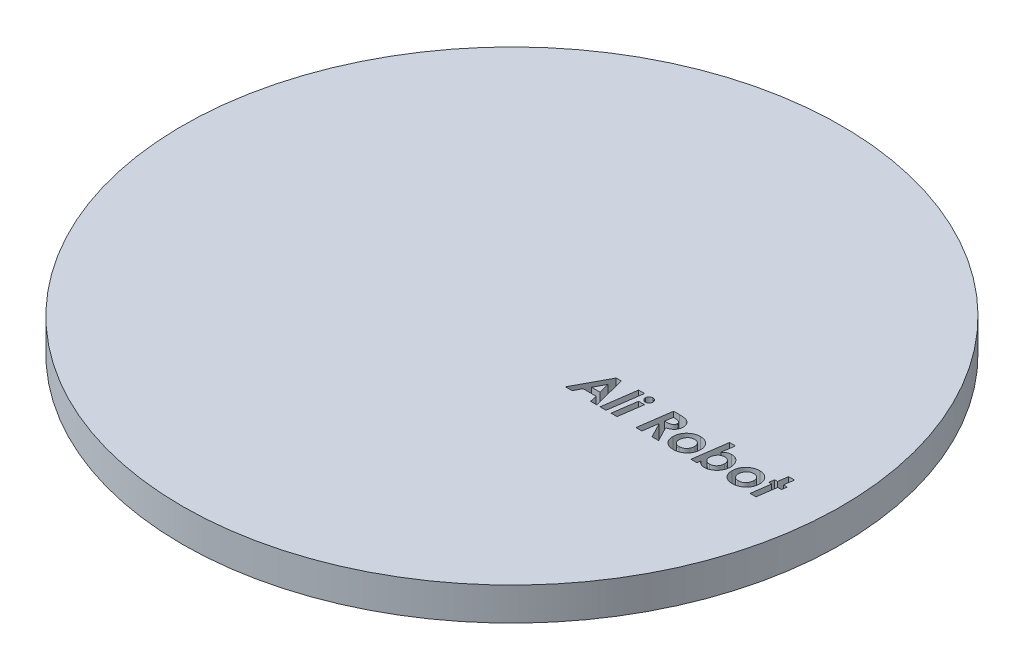
from build123d import *

# Parameters (mm, degrees)
SKETCH2_R           = 35
BOSS_EXTRUDE1_DEPTH = 3.5
SKETCH33_R          = 30
BOSS_EXTRUDE3_DEPTH = 2.2
CUT_EXTRUDE24_DEPTH = 3
SKETCH35_W          = 5.8
SKETCH35_H          = 3.4
BOSS_EXTRUDE4_DEPTH = 6
SHELL2_T            = 1


with BuildPart() as part:
    # Sketch2 → Boss-Extrude1 (new body)
    with BuildSketch(Plane(origin=(0, 0, 0), x_dir=(1, 0, 0), z_dir=(0, 1, 0))):
        Circle(SKETCH2_R)
    extrude(amount=BOSS_EXTRUDE1_DEPTH)

    # Sketch33 → Boss-Extrude3 (add)
    with BuildSketch(Plane.XZ):
        Circle(SKETCH33_R)
    extrude(amount=BOSS_EXTRUDE3_DEPTH)

    # Sketch38 → Cut-Extrude24 (cut)
    # profile 1 of 9: a face of its own
    with BuildSketch(Plane(origin=(0, 3.5, 0), x_dir=(1, 0, 0), z_dir=(0, 1, 0))):
        Polygon((11.234213374, -0.170104505), (11.785295104, -0.170104505), (12.673616419, -3.670104505), (12.027182124, -3.670104505), (11.833672508, -2.907283992), (10.469289496, -2.907283992), (10.059834367, -3.670104505), (9.353103598, -3.670104505), align=None)
        Polygon((11.684333566, -2.323950659), (11.395471387, -1.184627742), (10.78339206, -2.323950659), align=None, mode=Mode.SUBTRACT)
    # profile 2 of 9: a face of its own
    with BuildSketch(Plane(origin=(0, 3.5, 0), x_dir=(1, 0, 0), z_dir=(0, 1, 0))):
        Polygon((13.535996226, -0.080360915), (14.169810329, -0.080360915), (13.66640488, -3.670104505), (13.032590778, -3.670104505), align=None)
    # profile 3 of 9: a face of its own
    with BuildSketch(Plane(origin=(0, 3.5, 0), x_dir=(1, 0, 0), z_dir=(0, 1, 0))):
        with BuildLine():
            add(Edge.make_bspline(
                [(15.006949752, -0.03548912), (15.033724236, -0.037050399), (15.086317182, -0.040117209), (15.162584245, -0.062149233), (15.231434376, -0.101556531), (15.293403814, -0.152881213), (15.344728495, -0.21485065), (15.384135793, -0.283700781), (15.406167817, -0.359967844), (15.409234627, -0.41256079), (15.410795906, -0.439335274)],
                knots=[0, 0, 0, 0, 1.014134371, 1.992057583, 2.975098753, 4, 5.024901247, 6.007942417, 6.985865629, 8, 8, 8, 8], degree=3))
            add(Edge.make_bspline(
                [(15.410795906, -0.439335274), (15.409245272, -0.466115808), (15.406199373, -0.518720637), (15.383956784, -0.595099209), (15.344970591, -0.664433822), (15.29334378, -0.726417249), (15.231646153, -0.777958507), (15.162369408, -0.816365475), (15.086344614, -0.83860223), (15.03373349, -0.841636642), (15.006949752, -0.843181428)],
                knots=[0, 0, 0, 0, 1.013694729, 1.991193998, 2.981551723, 4.006008661, 5.030465598, 6.008806002, 6.986305271, 8, 8, 8, 8], degree=3))
            add(Edge.make_bspline(
                [(15.006949752, -0.843181428), (14.980160104, -0.841647208), (14.927537372, -0.83863355), (14.85139842, -0.816186723), (14.781641719, -0.77820039), (14.719927005, -0.726358021), (14.668084636, -0.664643307), (14.630098303, -0.594886606), (14.607651476, -0.518747654), (14.604637818, -0.466124922), (14.603103598, -0.439335274)],
                knots=[0, 0, 0, 0, 1.01324697, 1.990314468, 2.975995575, 4, 5.024004425, 6.009685532, 6.98675303, 8, 8, 8, 8], degree=3))
            add(Edge.make_bspline(
                [(14.603103598, -0.439335274), (14.604648384, -0.412551536), (14.607682796, -0.359940413), (14.629919552, -0.283915618), (14.668326519, -0.214638873), (14.719867777, -0.152941246), (14.781851204, -0.101314435), (14.851185818, -0.062328242), (14.927564389, -0.040085653), (14.980169218, -0.037039754), (15.006949752, -0.03548912)],
                knots=[0, 0, 0, 0, 1.013694729, 1.991193998, 2.969534402, 3.993991339, 5.018448277, 6.008806002, 6.986305271, 8, 8, 8, 8], degree=3))
        make_face()
    # profile 4 of 9: a face of its own
    with BuildSketch(Plane(origin=(0, 3.5, 0), x_dir=(1, 0, 0), z_dir=(0, 1, 0))):
        Polygon((14.562438534, -1.112412197), (15.196252637, -1.112412197), (14.833071547, -3.670104505), (14.199257444, -3.670104505), align=None)
    # profile 5 of 9: a face of its own
    with BuildSketch(Plane(origin=(0, 3.5, 0), x_dir=(1, 0, 0), z_dir=(0, 1, 0))):
        with BuildLine():
            Line((17.337478598, -0.170104505), (17.945351194, -0.170104505))
            add(Edge.make_bspline(
                [(17.945351194, -0.170104505), (17.990461912, -0.170288853), (18.0774408, -0.170644298), (18.20251927, -0.175698725), (18.317320027, -0.183324297), (18.421706567, -0.19338775), (18.515766042, -0.207350229), (18.599302851, -0.224114981), (18.672850562, -0.242784868), (18.716956864, -0.260134145), (18.737618822, -0.268261556)],
                knots=[0, 0, 0, 0, 1.348808202, 2.600664361, 3.742342956, 4.788858012, 5.735658768, 6.584006912, 7.336666444, 8, 8, 8, 8], degree=3))
            add(Edge.make_bspline(
                [(18.737618822, -0.268261556), (18.760881531, -0.278751926), (18.806356444, -0.29925894), (18.871519344, -0.334019586), (18.932539327, -0.371466236), (18.988405098, -0.413010751), (19.040295597, -0.456903826), (19.087889056, -0.503562941), (19.130802248, -0.55370417), (19.169485538, -0.606428163), (19.203882551, -0.661666729), (19.233408844, -0.719692265), (19.258939718, -0.780013512), (19.278877214, -0.843286871), (19.29544767, -0.908752815), (19.30616484, -0.97682439), (19.313707078, -1.04727198), (19.314326819, -1.095096686), (19.31464206, -1.119423415)],
                knots=[0, 0, 0, 0, 1.116361014, 2.182309107, 3.229450697, 4.24598407, 5.225421932, 6.201651319, 7.158895679, 8.110002388, 9.060669178, 10.002827475, 10.956240434, 11.923213192, 12.902917952, 13.908279153, 14.936015885, 16, 16, 16, 16], degree=3))
            add(Edge.make_bspline(
                [(19.31464206, -1.119423415), (19.313900694, -1.14935913), (19.312437117, -1.208457078), (19.302873802, -1.295604951), (19.285037031, -1.379232383), (19.261016279, -1.459602808), (19.231256497, -1.537236615), (19.192877363, -1.610782918), (19.148515858, -1.681523171), (19.097282847, -1.748529924), (19.040017621, -1.812417855), (18.973896349, -1.869427088), (18.902576953, -1.923391655), (18.823129531, -1.97069347), (18.737739084, -2.014632643), (18.644457977, -2.051860582), (18.545036949, -2.086216223), (18.475324737, -2.103410743), (18.43964206, -2.112211877)],
                knots=[0, 0, 0, 0, 0.995453645, 1.965186658, 2.910129054, 3.83459069, 4.752398018, 5.669942118, 6.588407184, 7.525617038, 8.471772905, 9.435289717, 10.423772802, 11.441988612, 12.505459691, 13.613754905, 14.778583949, 16, 16, 16, 16], degree=3))
            Line((18.43964206, -2.112211877), (19.247334367, -3.670104505))
            Line((19.247334367, -3.670104505), (18.545511451, -3.670104505))
            Line((18.545511451, -3.670104505), (17.754646066, -2.144463479))
            Line((17.754646066, -2.144463479), (17.695050713, -2.144463479))
            Line((17.695050713, -2.144463479), (17.480507444, -3.670104505))
            Line((17.480507444, -3.670104505), (16.846693342, -3.670104505))
            Line((16.846693342, -3.670104505), (17.337478598, -0.170104505))
        make_face()
        with BuildLine():
            add(Edge.make_bspline(
                [(17.777081963, -1.561130146), (17.822194038, -1.560711256), (17.908482086, -1.559910025), (18.031718476, -1.554336883), (18.14284927, -1.545533343), (18.241553965, -1.532952509), (18.328092207, -1.518073936), (18.40209638, -1.499499099), (18.463905682, -1.477413957), (18.514495006, -1.451223183), (18.555475842, -1.42047266), (18.590946517, -1.387657032), (18.620482235, -1.350923569), (18.644851849, -1.31088895), (18.66364733, -1.267470195), (18.677201777, -1.220373146), (18.684696139, -1.16991183), (18.685848236, -1.135105351), (18.686436931, -1.11732005)],
                knots=[0, 0, 0, 0, 1.892208387, 3.619318591, 5.173427176, 6.566868293, 7.791773198, 8.8545744, 9.763297566, 10.539470204, 11.233547833, 11.906251103, 12.5615143, 13.203742025, 13.866659999, 14.539934446, 15.25394049, 16, 16, 16, 16], degree=3))
            add(Edge.make_bspline(
                [(18.686436931, -1.11732005), (18.685674889, -1.097154087), (18.68419663, -1.058034883), (18.671410296, -1.001691948), (18.649546106, -0.950581254), (18.618818966, -0.905191441), (18.580473147, -0.865168951), (18.53369335, -0.832205814), (18.479014112, -0.806257483), (18.427792709, -0.789114207), (18.379308966, -0.779184383), (18.334112776, -0.772512871), (18.280601749, -0.7660751), (18.218614928, -0.761314571), (18.148226827, -0.75816557), (18.069473284, -0.755105638), (17.982513177, -0.754017509), (17.921746603, -0.753636911), (17.889962572, -0.753437838)],
                knots=[0, 0, 0, 0, 0.974340854, 1.890087692, 2.776057671, 3.647490651, 4.526730822, 5.442477659, 6.397820337, 7.445016909, 8.045730266, 8.789007992, 9.653967296, 10.651691253, 11.794598421, 13.061237498, 14.462876682, 16, 16, 16, 16], degree=3))
            Line((17.889962572, -0.753437838), (17.777081963, -1.561130146))
        make_face(mode=Mode.SUBTRACT)
    # profile 6 of 9: a face of its own
    with BuildSketch(Plane(origin=(0, 3.5, 0), x_dir=(1, 0, 0), z_dir=(0, 1, 0))):
        with BuildLine():
            add(Edge.make_bspline(
                [(21.10390488, -1.067540402), (21.132205676, -1.067801263), (21.188216739, -1.068317542), (21.271251688, -1.076791941), (21.352561402, -1.088283547), (21.431755309, -1.105087467), (21.508763418, -1.127042832), (21.583911738, -1.1537877), (21.657385991, -1.185052775), (21.728169586, -1.221737771), (21.79620025, -1.2622808), (21.860854534, -1.306994684), (21.921055687, -1.356524279), (21.978491813, -1.408937638), (22.030743266, -1.466611664), (22.079230459, -1.527904512), (22.124539495, -1.592781526), (22.16560308, -1.661642395), (22.201764854, -1.734065485), (22.234420935, -1.808192303), (22.261103392, -1.885165214), (22.28235286, -1.964249823), (22.30065848, -2.045266898), (22.311711934, -2.128584003), (22.320319088, -2.213929685), (22.32080558, -2.271576635), (22.321052316, -2.30081364)],
                knots=[0, 0, 0, 0, 1.048380346, 2.074885017, 3.090367486, 4.090964834, 5.072523792, 6.056029873, 7.045505985, 8.029469653, 9.008388104, 9.979110116, 10.939576094, 11.895736256, 12.858269977, 13.820062943, 14.790784955, 15.789017664, 16.788414625, 17.789274365, 18.789121639, 19.804049856, 20.823403653, 21.864603227, 22.916983403, 24, 24, 24, 24], degree=3))
            add(Edge.make_bspline(
                [(22.321052316, -2.30081364), (22.319619601, -2.349019816), (22.316797746, -2.443966047), (22.297012332, -2.583639323), (22.263197648, -2.71753656), (22.215858626, -2.846045115), (22.155304616, -2.969198555), (22.081284251, -3.087107245), (21.992933579, -3.198542586), (21.893318647, -3.303762939), (21.784010872, -3.400153265), (21.666804377, -3.484466244), (21.543203881, -3.555740679), (21.413517543, -3.614546208), (21.276800052, -3.659246415), (21.134065161, -3.691262002), (20.985073188, -3.711747396), (20.883586993, -3.71388631), (20.831869624, -3.7149763)],
                knots=[0, 0, 0, 0, 1.011104245, 1.991457176, 2.952197104, 3.902991464, 4.858928698, 5.826026836, 6.817568841, 7.837123857, 8.861887107, 9.870051414, 10.860623363, 11.850212162, 12.851715058, 13.872153699, 14.915649431, 16, 16, 16, 16], degree=3))
            add(Edge.make_bspline(
                [(20.831869624, -3.7149763), (20.787180608, -3.714153797), (20.699859256, -3.712546645), (20.572535065, -3.696510448), (20.451951023, -3.671832677), (20.338440225, -3.635615998), (20.231550643, -3.590365048), (20.131718852, -3.534302422), (20.038690652, -3.468474255), (19.954355691, -3.391708196), (19.877584733, -3.307755196), (19.811040754, -3.216412915), (19.75412752, -3.118885549), (19.708910665, -3.014632036), (19.672882858, -2.904560186), (19.647014793, -2.788376728), (19.631256388, -2.665832705), (19.629593856, -2.582011467), (19.628744624, -2.53919505)],
                knots=[0, 0, 0, 0, 1.130534475, 2.209039425, 3.242686211, 4.241648197, 5.219495055, 6.175504508, 7.134035888, 8.097337106, 9.056251676, 10.008649417, 10.952170628, 11.908308165, 12.879116703, 13.879338768, 14.916752852, 16, 16, 16, 16], degree=3))
            add(Edge.make_bspline(
                [(19.628744624, -2.53919505), (19.630129394, -2.487484152), (19.63285354, -2.385757449), (19.653222978, -2.236445943), (19.688511473, -2.094173346), (19.737255381, -1.958685096), (19.798811542, -1.829343138), (19.876295949, -1.707787872), (19.966196952, -1.592038304), (20.069660962, -1.485284387), (20.181690912, -1.387899142), (20.299281022, -1.301752877), (20.422559058, -1.230100692), (20.549460565, -1.169585046), (20.682121593, -1.124371206), (20.818625267, -1.091170449), (20.959799348, -1.070900032), (21.055460923, -1.068669809), (21.10390488, -1.067540402)],
                knots=[0, 0, 0, 0, 1.070407058, 2.105725986, 3.11260329, 4.099768105, 5.082273654, 6.071629737, 7.078227986, 8.111679688, 9.144009435, 10.148605521, 11.124500349, 12.092034995, 13.054511379, 14.020338642, 14.997480131, 16, 16, 16, 16], degree=3))
        make_face()
        with BuildLine():
            add(Edge.make_bspline(
                [(21.057630842, -1.650873736), (21.026269955, -1.651636447), (20.965150904, -1.653122889), (20.876302302, -1.665982872), (20.79304741, -1.686932574), (20.715073471, -1.716261753), (20.643419269, -1.755392612), (20.576507562, -1.801790198), (20.516281479, -1.857752454), (20.462012486, -1.920664044), (20.414176698, -1.988504559), (20.372137329, -2.058299005), (20.336555272, -2.129766087), (20.308269609, -2.202725024), (20.284359334, -2.276698707), (20.268472408, -2.352366514), (20.259260913, -2.429591807), (20.257725534, -2.481444774), (20.256949752, -2.507644569)],
                knots=[0, 0, 0, 0, 1.147646984, 2.236642535, 3.278363253, 4.285788599, 5.277283386, 6.259990092, 7.25913394, 8.278119336, 9.296601724, 10.294389209, 11.258634566, 12.215104854, 13.156804447, 14.101569642, 15.040778374, 16, 16, 16, 16], degree=3))
            add(Edge.make_bspline(
                [(20.256949752, -2.507644569), (20.257532631, -2.530566622), (20.258672044, -2.575374643), (20.26627562, -2.640906789), (20.279776611, -2.702779036), (20.297767954, -2.76144146), (20.321967792, -2.816579396), (20.351167991, -2.868405184), (20.386215923, -2.916407622), (20.424970871, -2.961466715), (20.469417067, -3.001175849), (20.516988562, -3.036297243), (20.568043814, -3.066353198), (20.623114972, -3.08986505), (20.681451247, -3.109062165), (20.743278336, -3.12217512), (20.808531786, -3.129982068), (20.853114676, -3.131078932), (20.876040297, -3.131642967)],
                knots=[0, 0, 0, 0, 1.110133544, 2.170088686, 3.189065258, 4.17351184, 5.136579884, 6.099647928, 7.048308506, 8.010844321, 8.972448026, 9.927769731, 10.871216919, 11.834284962, 12.822174017, 13.841150589, 14.889866456, 16, 16, 16, 16], degree=3))
            add(Edge.make_bspline(
                [(20.876040297, -3.131642967), (20.908327519, -3.13081147), (20.971260249, -3.129190756), (21.062683434, -3.117309576), (21.148088828, -3.097133982), (21.227451551, -3.068248614), (21.300688371, -3.030725324), (21.368699859, -2.985891305), (21.429944961, -2.931876311), (21.48509304, -2.870934664), (21.533550481, -2.804751067), (21.575853609, -2.735370924), (21.612525236, -2.664120492), (21.642112388, -2.59018004), (21.664496143, -2.514049921), (21.680676275, -2.435740061), (21.690718735, -2.355059531), (21.692133156, -2.300374861), (21.692847188, -2.272768768)],
                knots=[0, 0, 0, 0, 1.164111062, 2.269030304, 3.317651816, 4.322802953, 5.30652745, 6.278887004, 7.252451034, 8.242831511, 9.237327035, 10.205734188, 11.170614506, 12.123681709, 13.072978069, 14.028315502, 15.004647829, 16, 16, 16, 16], degree=3))
            add(Edge.make_bspline(
                [(21.692847188, -2.272768768), (21.692320588, -2.250308024), (21.691285496, -2.206158886), (21.68279286, -2.141566002), (21.668601759, -2.080413151), (21.649936064, -2.022074887), (21.624294897, -1.967648418), (21.59433855, -1.915645637), (21.557203679, -1.868141891), (21.516160513, -1.823345671), (21.47081675, -1.782623151), (21.42121727, -1.747521842), (21.368893834, -1.71708776), (21.312660418, -1.693288489), (21.253512837, -1.674378403), (21.19119306, -1.66009748), (21.125354829, -1.652631844), (21.080550835, -1.651468737), (21.057630842, -1.650873736)],
                knots=[0, 0, 0, 0, 1.079193067, 2.121276228, 3.123935011, 4.093589047, 5.058482656, 6.010079462, 6.971567708, 7.949254825, 8.927715837, 9.893916005, 10.864935156, 11.830939453, 12.821955205, 13.846519011, 14.898362312, 16, 16, 16, 16], degree=3))
        make_face(mode=Mode.SUBTRACT)
    # profile 7 of 9: a face of its own
    with BuildSketch(Plane(origin=(0, 3.5, 0), x_dir=(1, 0, 0), z_dir=(0, 1, 0))):
        with BuildLine():
            Line((23.313840778, -3.670104505), (22.680026675, -3.670104505))
            Line((22.680026675, -3.670104505), (23.183432124, -0.080360915))
            Line((23.183432124, -0.080360915), (23.816545104, -0.080360915))
            Line((23.816545104, -0.080360915), (23.62724222, -1.431422614))
            add(Edge.make_bspline(
                [(23.62724222, -1.431422614), (23.660177044, -1.399109951), (23.722878643, -1.337592827), (23.819913625, -1.257983779), (23.913193306, -1.193936975), (24.005187179, -1.145305221), (24.098742939, -1.110612562), (24.195640627, -1.085114674), (24.298223302, -1.070244068), (24.368279889, -1.068454853), (24.404085169, -1.067540402)],
                knots=[0, 0, 0, 0, 1.251006972, 2.381677804, 3.399685655, 4.315539795, 5.196231247, 6.100316428, 7.029089122, 8, 8, 8, 8], degree=3))
            add(Edge.make_bspline(
                [(24.404085169, -1.067540402), (24.445287674, -1.068485671), (24.525749337, -1.070331624), (24.643204002, -1.088646533), (24.754232376, -1.117047879), (24.859019208, -1.15696827), (24.956475295, -1.209814729), (25.048312142, -1.272826908), (25.132725115, -1.348770844), (25.209846362, -1.434799464), (25.27933836, -1.527884039), (25.33968521, -1.62604411), (25.392255494, -1.727123958), (25.434281606, -1.832633065), (25.466552847, -1.941835417), (25.48961194, -2.054416651), (25.504092748, -2.170730285), (25.505988174, -2.249589314), (25.506949752, -2.289595691)],
                knots=[0, 0, 0, 0, 1.074461769, 2.098245705, 3.093738161, 4.060957578, 5.015928931, 5.980202173, 6.960712075, 7.971130566, 8.990819314, 9.98765587, 10.975026468, 11.960285364, 12.946317818, 13.942631884, 14.956266082, 16, 16, 16, 16], degree=3))
            add(Edge.make_bspline(
                [(25.506949752, -2.289595691), (25.506485439, -2.320470332), (25.505561779, -2.381889453), (25.495813586, -2.473415201), (25.4813639, -2.564117418), (25.460305544, -2.653867108), (25.432779537, -2.742293146), (25.399567925, -2.82953584), (25.361221982, -2.915948082), (25.316298398, -3.000256141), (25.266843562, -3.082073165), (25.212840452, -3.159694669), (25.155387397, -3.233294504), (25.092786476, -3.301015233), (25.02655498, -3.364505202), (24.956494381, -3.423572461), (24.881754013, -3.47756321), (24.803840208, -3.527078419), (24.723179042, -3.57113124), (24.641359309, -3.609869553), (24.558288967, -3.6420021), (24.474837248, -3.668999362), (24.390386293, -3.689199505), (24.305160276, -3.703946802), (24.218975194, -3.713542499), (24.161054574, -3.714497878), (24.132049912, -3.7149763)],
                knots=[0, 0, 0, 0, 1.013451801, 2.016066107, 3.019062145, 4.027971124, 5.040172772, 6.057828882, 7.091818133, 8.14227902, 9.192543668, 10.229263228, 11.245616414, 12.255867067, 13.254567598, 14.256800029, 15.26222985, 16.27988596, 17.286164752, 18.278298122, 19.250221527, 20.208875209, 21.15628221, 22.098734397, 23.047911355, 24, 24, 24, 24], degree=3))
            add(Edge.make_bspline(
                [(24.132049912, -3.7149763), (24.093171265, -3.713587548), (24.016277583, -3.710840893), (23.903498917, -3.690228625), (23.79579298, -3.655262854), (23.693309546, -3.607746487), (23.597518856, -3.546982021), (23.511655579, -3.471759408), (23.432370037, -3.386507872), (23.389570427, -3.320715947), (23.367827156, -3.287292005)],
                knots=[0, 0, 0, 0, 1.017645626, 2.01268628, 2.989956243, 3.975524875, 4.963465289, 5.948444836, 6.95775873, 8, 8, 8, 8], degree=3))
            Line((23.367827156, -3.287292005), (23.313840778, -3.670104505))
        make_face()
        with BuildLine():
            add(Edge.make_bspline(
                [(24.265263053, -1.650873736), (24.228968933, -1.652102616), (24.158238745, -1.654497465), (24.055407816, -1.672667991), (23.960088703, -1.704745444), (23.871134011, -1.748066448), (23.790345373, -1.806273578), (23.715653776, -1.877031365), (23.649507263, -1.963123617), (23.590054465, -2.059494251), (23.541668223, -2.163617884), (23.505225164, -2.270612742), (23.483457468, -2.379392755), (23.480684848, -2.452396344), (23.479305521, -2.488714281)],
                knots=[0, 0, 0, 0, 1.020631644, 1.989012793, 2.92445932, 3.841689372, 4.76099003, 5.714169008, 6.725443104, 7.805523698, 8.893656079, 9.947594549, 10.978966212, 12, 12, 12, 12], degree=3))
            add(Edge.make_bspline(
                [(23.479305521, -2.488714281), (23.479880618, -2.512339552), (23.481005486, -2.558549754), (23.488729431, -2.626136473), (23.501772501, -2.690088284), (23.52120186, -2.750219249), (23.544746002, -2.807313215), (23.574290204, -2.860601683), (23.609165582, -2.910337835), (23.648779905, -2.956220431), (23.692954796, -2.997921983), (23.741494491, -3.033429202), (23.793008881, -3.064116944), (23.848068499, -3.088256666), (23.905962492, -3.108722547), (23.967819684, -3.121165115), (24.032692366, -3.130219437), (24.077094213, -3.131161341), (24.09979831, -3.131642967)],
                knots=[0, 0, 0, 0, 1.126186038, 2.20278045, 3.238531955, 4.232199798, 5.210951865, 6.178414309, 7.130420157, 8.102043749, 9.063714879, 10.019689469, 10.96364203, 11.916169311, 12.881576601, 13.884632073, 14.918344105, 16, 16, 16, 16], degree=3))
            add(Edge.make_bspline(
                [(24.09979831, -3.131642967), (24.126486516, -3.131068206), (24.178941073, -3.129938537), (24.255911966, -3.118063791), (24.330043349, -3.100131687), (24.400958776, -3.074004662), (24.468729446, -3.040689075), (24.533661769, -3.000757277), (24.594945241, -2.952450746), (24.652597178, -2.897439839), (24.705687784, -2.836877111), (24.752381551, -2.771554995), (24.791000144, -2.701195744), (24.82348501, -2.627193526), (24.847714734, -2.548490868), (24.86639777, -2.466085248), (24.87672908, -2.379136017), (24.878065423, -2.319769131), (24.878744624, -2.289595691)],
                knots=[0, 0, 0, 0, 0.998366777, 1.962248238, 2.9086585, 3.849756023, 4.784937843, 5.731833278, 6.697935849, 7.700472628, 8.711184204, 9.708937404, 10.699800307, 11.710776929, 12.729071636, 13.777697986, 14.87050675, 16, 16, 16, 16], degree=3))
            add(Edge.make_bspline(
                [(24.878744624, -2.289595691), (24.878166027, -2.266205274), (24.877034532, -2.220463372), (24.869363374, -2.153555367), (24.85608738, -2.090150181), (24.837192797, -2.030183276), (24.812400245, -1.97397123), (24.782987899, -1.920860313), (24.74762681, -1.87173701), (24.707682685, -1.826223703), (24.663776511, -1.784799273), (24.615888899, -1.749077356), (24.565052455, -1.718418003), (24.510699896, -1.694240055), (24.453915097, -1.674028431), (24.393539086, -1.661235902), (24.330498066, -1.652349873), (24.287264398, -1.651371582), (24.265263053, -1.650873736)],
                knots=[0, 0, 0, 0, 1.12759846, 2.205112442, 3.24149039, 4.246337781, 5.230184043, 6.198685213, 7.167907017, 8.141962875, 9.114453566, 10.072146408, 11.017028515, 11.970004121, 12.93561737, 13.916944341, 14.939945928, 16, 16, 16, 16], degree=3))
        make_face(mode=Mode.SUBTRACT)
    # profile 8 of 9: a face of its own
    with BuildSketch(Plane(origin=(0, 3.5, 0), x_dir=(1, 0, 0), z_dir=(0, 1, 0))):
        with BuildLine():
            add(Edge.make_bspline(
                [(27.385956162, -1.067540402), (27.414256958, -1.067801263), (27.470268021, -1.068317542), (27.55330297, -1.076791941), (27.634612684, -1.088283547), (27.713806591, -1.105087467), (27.7908147, -1.127042832), (27.86596302, -1.1537877), (27.939437273, -1.185052775), (28.010220868, -1.221737771), (28.078251532, -1.2622808), (28.142905816, -1.306994684), (28.203106969, -1.356524279), (28.260543095, -1.408937638), (28.312794548, -1.466611664), (28.361281741, -1.527904512), (28.406590777, -1.592781526), (28.447654362, -1.661642395), (28.483816136, -1.734065485), (28.516472217, -1.808192303), (28.543154674, -1.885165214), (28.564404142, -1.964249823), (28.582709762, -2.045266898), (28.593763216, -2.128584003), (28.60237037, -2.213929685), (28.602856862, -2.271576635), (28.603103598, -2.30081364)],
                knots=[0, 0, 0, 0, 1.048380346, 2.074885017, 3.090367486, 4.090964834, 5.072523792, 6.056029873, 7.045505985, 8.029469653, 9.008388104, 9.979110116, 10.939576094, 11.895736256, 12.858269977, 13.820062943, 14.790784955, 15.789017664, 16.788414625, 17.789274365, 18.789121639, 19.804049856, 20.823403653, 21.864603227, 22.916983403, 24, 24, 24, 24], degree=3))
            add(Edge.make_bspline(
                [(28.603103598, -2.30081364), (28.601670883, -2.349019816), (28.598849028, -2.443966047), (28.579063614, -2.583639323), (28.54524893, -2.71753656), (28.497909908, -2.846045115), (28.437355898, -2.969198555), (28.363335533, -3.087107245), (28.274984861, -3.198542586), (28.175369929, -3.303762939), (28.066062154, -3.400153265), (27.948855659, -3.484466244), (27.825255163, -3.555740679), (27.695568825, -3.614546208), (27.558851334, -3.659246415), (27.416116443, -3.691262002), (27.26712447, -3.711747396), (27.165638275, -3.71388631), (27.113920906, -3.7149763)],
                knots=[0, 0, 0, 0, 1.011104245, 1.991457176, 2.952197104, 3.902991464, 4.858928698, 5.826026836, 6.817568841, 7.837123857, 8.861887107, 9.870051414, 10.860623363, 11.850212162, 12.851715058, 13.872153699, 14.915649431, 16, 16, 16, 16], degree=3))
            add(Edge.make_bspline(
                [(27.113920906, -3.7149763), (27.06923189, -3.714153797), (26.981910538, -3.712546645), (26.854586347, -3.696510448), (26.734002305, -3.671832677), (26.620491507, -3.635615998), (26.513601925, -3.590365048), (26.413770134, -3.534302422), (26.320741934, -3.468474255), (26.236406974, -3.391708196), (26.159636015, -3.307755196), (26.093092036, -3.216412915), (26.036178802, -3.118885549), (25.990961947, -3.014632036), (25.95493414, -2.904560186), (25.929066075, -2.788376728), (25.913307671, -2.665832705), (25.911645138, -2.582011467), (25.910795906, -2.53919505)],
                knots=[0, 0, 0, 0, 1.130534475, 2.209039425, 3.242686211, 4.241648197, 5.219495055, 6.175504508, 7.134035888, 8.097337106, 9.056251676, 10.008649417, 10.952170628, 11.908308165, 12.879116703, 13.879338768, 14.916752852, 16, 16, 16, 16], degree=3))
            add(Edge.make_bspline(
                [(25.910795906, -2.53919505), (25.912180676, -2.487484152), (25.914904822, -2.385757449), (25.93527426, -2.236445943), (25.970562755, -2.094173346), (26.019306663, -1.958685096), (26.080862824, -1.829343138), (26.158347231, -1.707787872), (26.248248234, -1.592038304), (26.351712244, -1.485284387), (26.463742194, -1.387899142), (26.581332304, -1.301752877), (26.70461034, -1.230100692), (26.831511847, -1.169585046), (26.964172875, -1.124371206), (27.100676549, -1.091170449), (27.24185063, -1.070900032), (27.337512205, -1.068669809), (27.385956162, -1.067540402)],
                knots=[0, 0, 0, 0, 1.070407058, 2.105725986, 3.11260329, 4.099768105, 5.082273654, 6.071629737, 7.078227986, 8.111679688, 9.144009435, 10.148605521, 11.124500349, 12.092034995, 13.054511379, 14.020338642, 14.997480131, 16, 16, 16, 16], degree=3))
        make_face()
        with BuildLine():
            add(Edge.make_bspline(
                [(27.339682124, -1.650873736), (27.308321237, -1.651636447), (27.247202186, -1.653122889), (27.158353584, -1.665982872), (27.075098692, -1.686932574), (26.997124753, -1.716261753), (26.925470551, -1.755392612), (26.858558844, -1.801790198), (26.798332761, -1.857752454), (26.744063768, -1.920664044), (26.69622798, -1.988504559), (26.654188611, -2.058299005), (26.618606554, -2.129766087), (26.590320891, -2.202725024), (26.566410616, -2.276698707), (26.55052369, -2.352366514), (26.541312195, -2.429591807), (26.539776816, -2.481444774), (26.539001034, -2.507644569)],
                knots=[0, 0, 0, 0, 1.147646984, 2.236642535, 3.278363253, 4.285788599, 5.277283386, 6.259990092, 7.25913394, 8.278119336, 9.296601724, 10.294389209, 11.258634566, 12.215104854, 13.156804447, 14.101569642, 15.040778374, 16, 16, 16, 16], degree=3))
            add(Edge.make_bspline(
                [(26.539001034, -2.507644569), (26.539583913, -2.530566622), (26.540723326, -2.575374643), (26.548326902, -2.640906789), (26.561827893, -2.702779036), (26.579819236, -2.76144146), (26.604019074, -2.816579396), (26.633219273, -2.868405184), (26.668267205, -2.916407622), (26.707022153, -2.961466715), (26.751468349, -3.001175849), (26.799039844, -3.036297243), (26.850095096, -3.066353198), (26.905166254, -3.08986505), (26.963502529, -3.109062165), (27.025329618, -3.12217512), (27.090583068, -3.129982068), (27.135165958, -3.131078932), (27.158091579, -3.131642967)],
                knots=[0, 0, 0, 0, 1.110133544, 2.170088686, 3.189065258, 4.17351184, 5.136579884, 6.099647928, 7.048308506, 8.010844321, 8.972448026, 9.927769731, 10.871216919, 11.834284962, 12.822174017, 13.841150589, 14.889866456, 16, 16, 16, 16], degree=3))
            add(Edge.make_bspline(
                [(27.158091579, -3.131642967), (27.190378801, -3.13081147), (27.253311531, -3.129190756), (27.344734716, -3.117309576), (27.43014011, -3.097133982), (27.509502833, -3.068248614), (27.582739653, -3.030725324), (27.650751141, -2.985891305), (27.711996243, -2.931876311), (27.767144322, -2.870934664), (27.815601763, -2.804751067), (27.857904891, -2.735370924), (27.894576518, -2.664120492), (27.92416367, -2.59018004), (27.946547425, -2.514049921), (27.962727557, -2.435740061), (27.972770017, -2.355059531), (27.974184438, -2.300374861), (27.97489847, -2.272768768)],
                knots=[0, 0, 0, 0, 1.164111062, 2.269030304, 3.317651816, 4.322802953, 5.30652745, 6.278887004, 7.252451034, 8.242831511, 9.237327035, 10.205734188, 11.170614506, 12.123681709, 13.072978069, 14.028315502, 15.004647829, 16, 16, 16, 16], degree=3))
            add(Edge.make_bspline(
                [(27.97489847, -2.272768768), (27.97437187, -2.250308024), (27.973336778, -2.206158886), (27.964844142, -2.141566002), (27.950653041, -2.080413151), (27.931987347, -2.022074887), (27.906346179, -1.967648418), (27.876389832, -1.915645637), (27.839254961, -1.868141891), (27.798211795, -1.823345671), (27.752868032, -1.782623151), (27.703268552, -1.747521842), (27.650945116, -1.71708776), (27.5947117, -1.693288489), (27.535564119, -1.674378403), (27.473244342, -1.66009748), (27.407406111, -1.652631844), (27.362602117, -1.651468737), (27.339682124, -1.650873736)],
                knots=[0, 0, 0, 0, 1.079193067, 2.121276228, 3.123935011, 4.093589047, 5.058482656, 6.010079462, 6.971567708, 7.949254825, 8.927715837, 9.893916005, 10.864935156, 11.830939453, 12.821955205, 13.846519011, 14.898362312, 16, 16, 16, 16], degree=3))
        make_face(mode=Mode.SUBTRACT)
    # profile 9 of 9: a face of its own
    with BuildSketch(Plane(origin=(0, 3.5, 0), x_dir=(1, 0, 0), z_dir=(0, 1, 0))):
        Polygon((29.459874431, -0.080360915), (30.092987412, -0.080360915), (29.949958566, -1.112412197), (30.350299111, -1.112412197), (30.274577957, -1.650873736), (29.874938534, -1.650873736), (29.595190938, -3.670104505), (28.962077957, -3.670104505), (29.241825553, -1.650873736), (28.93192972, -1.650873736), (29.004846387, -1.112412197), (29.316845585, -1.112412197), align=None)
    extrude(amount=-CUT_EXTRUDE24_DEPTH, mode=Mode.SUBTRACT)


with BuildPart() as body_2:
    # Sketch35 → Boss-Extrude4 (new body)
    with BuildSketch(Plane(origin=(64.920383929, -4.2, -6.612415768), x_dir=(1, 0, 0), z_dir=(0, 1, 0))):
        with Locations((-65.334450623, -6.585655637)):
            Rectangle(SKETCH35_W, SKETCH35_H)
    extrude(amount=-BOSS_EXTRUDE4_DEPTH)

    # Shell2
    shell2_openings = [body_2.faces().sort_by_distance(p)[0] for p in [
        (-0.414066694, -10.2, -0.026760131),
    ]]
    offset(amount=SHELL2_T, openings=shell2_openings, kind=Kind.INTERSECTION)


solid = Compound([part.part, body_2.part])
